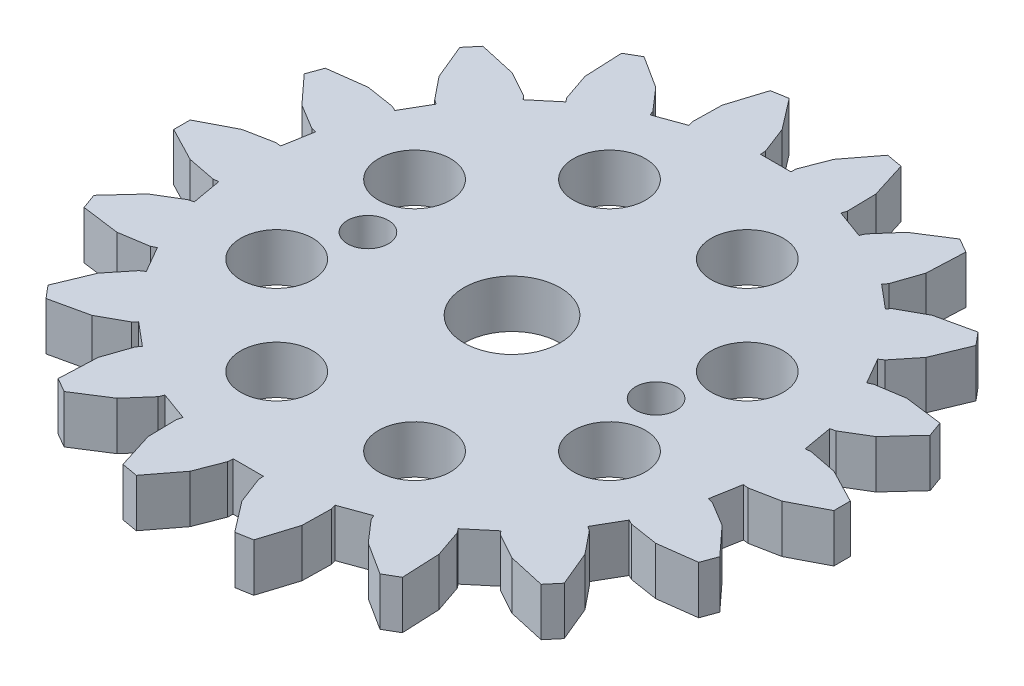
from build123d import *

# Parameters (mm, degrees)
BOSS_EXTRUDE1_DEPTH = 4
CUT_EXTRUDE1_REACH  = 83.172
SKETCH3_R           = 4
SKETCH3_R_2         = 1.7
CUT_EXTRUDE2_REACH  = 83.172
SKETCH4_R           = 3
CIRPATTERN1_COUNT   = 8


with BuildPart() as part:
    # Sketch2 → Boss-Extrude1 (new body)
    with BuildSketch(Plane(origin=(0, 0, 0), x_dir=(1, 0, 0), z_dir=(0, 1, 0))):
        Polygon((52.538734218, 31.842538875), (52.966809318, 31.892862657), (55.345625477, 31.426126758), (58.18102676, 29.953783051), (58.18102676, 28.584463126), (55.345625477, 27.112119419), (52.966809318, 26.64538352), (52.538734218, 26.695707302), (52.101156541, 24.214732135), (52.520808121, 24.115596779), (54.59638672, 22.863553353), (56.757494627, 20.510006991), (56.289031474, 19.223191192), (53.12080355, 18.809586915), (50.72600436, 19.184530393), (50.340910107, 19.378265245), (49.081307935, 17.196423401), (49.441564779, 16.959924277), (50.963799881, 15.07332886), (52.189708735, 12.122809954), (51.309369324, 11.073573865), (48.190601939, 11.768601179), (46.068586453, 12.939866968), (45.772908404, 13.25368769), (43.842900517, 11.634261062), (44.100782542, 11.288690853), (44.885873492, 8.995402472), (45.028637129, 5.803632771), (43.842684706, 5.118756998), (41.149615437, 6.838398802), (39.556106805, 8.664951285), (39.385697153, 9.061061087), (37.018327401, 8.199295971), (37.142300931, 7.786339893), (37.095648999, 5.362815632), (36.138204566, 2.314673579), (34.789402002, 2.076878058), (32.847083699, 4.613576876), (31.97451961, 6.875115771), (31.949681435, 7.305566323), (29.430477092, 7.305566323), (29.405639683, 6.875115771), (28.533075594, 4.613576876), (26.590757291, 2.076878058), (25.241954726, 2.314673579), (24.284510294, 5.362815632), (24.237858361, 7.786339893), (24.361831127, 8.199295971), (21.994461374, 9.061061087), (21.824052488, 8.664951285), (20.230543856, 6.838398802), (17.537474587, 5.118756998), (16.351521398, 5.803632771), (16.494285035, 8.995402472), (17.279376751, 11.288690853), (17.537258011, 11.634261062), (15.607250889, 13.25368769), (15.311572074, 12.939866968), (13.189557354, 11.768601179), (10.070789203, 11.073573865), (9.190449792, 12.122809954), (10.416359412, 15.07332886), (11.938594514, 16.959924277), (12.298851357, 17.196423401), (11.039249186, 19.378265245), (10.654154168, 19.184530393), (8.259354977, 18.809586915), (5.091127819, 19.223191192), (4.622664666, 20.510006991), (6.783771808, 22.863553353), (8.859351172, 24.115596779), (9.279002752, 24.214732135), (8.84142431, 26.695707302), (8.413349975, 26.64538352), (6.034533051, 27.112119419), (3.199132533, 28.584463126), (3.199132533, 29.953783051), (6.034533051, 31.426126758), (8.413349975, 31.892862657), (8.84142431, 31.842538875), (9.279002752, 34.323514042), (8.859351172, 34.422649398), (6.783771808, 35.674692824), (4.622664666, 38.028239186), (5.091127819, 39.315054985), (8.259354977, 39.728659262), (10.654154168, 39.353715784), (11.039249186, 39.159980932), (12.298851357, 41.341822776), (11.938594514, 41.5783219), (10.416359412, 43.464917317), (9.190449792, 46.415436223), (10.070789203, 47.464672312), (13.189557354, 46.769644998), (15.311572074, 45.598379209), (15.607250889, 45.284558487), (17.537258011, 46.903985115), (17.279376751, 47.249555324), (16.494285035, 49.542843705), (16.351521398, 52.734613406), (17.537474587, 53.41948918), (20.230543856, 51.699847375), (21.824052488, 49.873294892), (21.994461374, 49.47718509), (24.361831127, 50.338950206), (24.237858361, 50.751906284), (24.284510294, 53.175430545), (25.241954726, 56.223572598), (26.590757291, 56.46136812), (28.533075594, 53.924669301), (29.405639683, 51.663130406), (29.430477092, 51.232679854), (31.949681435, 51.232679854), (31.97451961, 51.663130406), (32.847083699, 53.924669301), (34.789402002, 56.46136812), (36.138204566, 56.223572598), (37.095648999, 53.175430545), (37.142300931, 50.751906284), (37.018327401, 50.338950206), (39.385697153, 49.47718509), (39.556106805, 49.873294892), (41.149615437, 51.699847375), (43.842684706, 53.41948918), (45.028637129, 52.734613406), (44.885873492, 49.542843705), (44.100782542, 47.249555324), (43.842900517, 46.903985115), (45.772908404, 45.284558487), (46.068586453, 45.598379209), (48.190601939, 46.769644998), (51.309369324, 47.464672312), (52.189708735, 46.415436223), (50.963799881, 43.464917317), (49.441564779, 41.5783219), (49.081307935, 41.341822776), (50.340910107, 39.159980932), (50.72600436, 39.353715784), (53.12080355, 39.728659262), (56.289031474, 39.315054985), (56.757494627, 38.028239186), (54.59638672, 35.674692824), (52.520808121, 34.422649398), (52.101156541, 34.323514042), align=None)
    extrude(amount=BOSS_EXTRUDE1_DEPTH)

    # Sketch3 → Cut-Extrude1 (cut, up to next)
    with BuildSketch(Plane(origin=(0, 0, 0), x_dir=(1, 0, 0), z_dir=(0, 1, 0)), mode=Mode.PRIVATE) as cut_extrude1_sk1:
        with Locations((30.690079264, 29.269123089)):
            Circle(SKETCH3_R)
    cut_extrude1_tool1 = extrude(cut_extrude1_sk1.sketch, amount=CUT_EXTRUDE1_REACH, mode=Mode.PRIVATE) & part.part
    # Sketch3 → Cut-Extrude1 (cut, up to next)
    with BuildSketch(Plane(origin=(0, 0, 0), x_dir=(1, 0, 0), z_dir=(0, 1, 0)), mode=Mode.PRIVATE) as cut_extrude1_sk2:
        with Locations((18.690079264, 29.269123089)):
            Circle(SKETCH3_R_2)
    cut_extrude1_tool2 = extrude(cut_extrude1_sk2.sketch, amount=CUT_EXTRUDE1_REACH, mode=Mode.PRIVATE) & part.part
    # Sketch3 → Cut-Extrude1 (cut, up to next)
    with BuildSketch(Plane(origin=(0, 0, 0), x_dir=(1, 0, 0), z_dir=(0, 1, 0)), mode=Mode.PRIVATE) as cut_extrude1_sk3:
        with Locations((42.690079264, 29.269123089)):
            Circle(SKETCH3_R_2)
    cut_extrude1_tool3 = extrude(cut_extrude1_sk3.sketch, amount=CUT_EXTRUDE1_REACH, mode=Mode.PRIVATE) & part.part
    add(cut_extrude1_tool1.solids().sort_by_distance((30.690079, 0, -29.269123))[0], mode=Mode.SUBTRACT)
    add(cut_extrude1_tool2.solids().sort_by_distance((18.690079, 0, -29.269123))[0], mode=Mode.SUBTRACT)
    add(cut_extrude1_tool3.solids().sort_by_distance((42.690079, 0, -29.269123))[0], mode=Mode.SUBTRACT)

    # Sketch4 → Cut-Extrude2 (cut, up to next)
    with BuildSketch(Plane(origin=(0, 0, 0), x_dir=(1, 0, 0), z_dir=(0, 1, 0)), mode=Mode.PRIVATE) as cut_extrude2_sk1:
        with Locations((16.831886276, 35.009374574)):
            Circle(SKETCH4_R)
    cut_extrude2_tool1 = extrude(cut_extrude2_sk1.sketch, amount=CUT_EXTRUDE2_REACH, mode=Mode.PRIVATE) & part.part
    cut_extrude2 = cut_extrude2_tool1.solids().sort_by_distance((16.831886, 0, -35.009375))[0]
    add(cut_extrude2, mode=Mode.SUBTRACT)

    # CirPattern1: Cut-Extrude2 ×8 about axis
    cirpattern1_axis = Axis((30.690079264, 4, -29.269123089), (0, -1, 0))
    for i in range(1, CIRPATTERN1_COUNT):
        add(cut_extrude2.rotate(cirpattern1_axis, i * 360 / CIRPATTERN1_COUNT), mode=Mode.SUBTRACT)


solid = part.part
